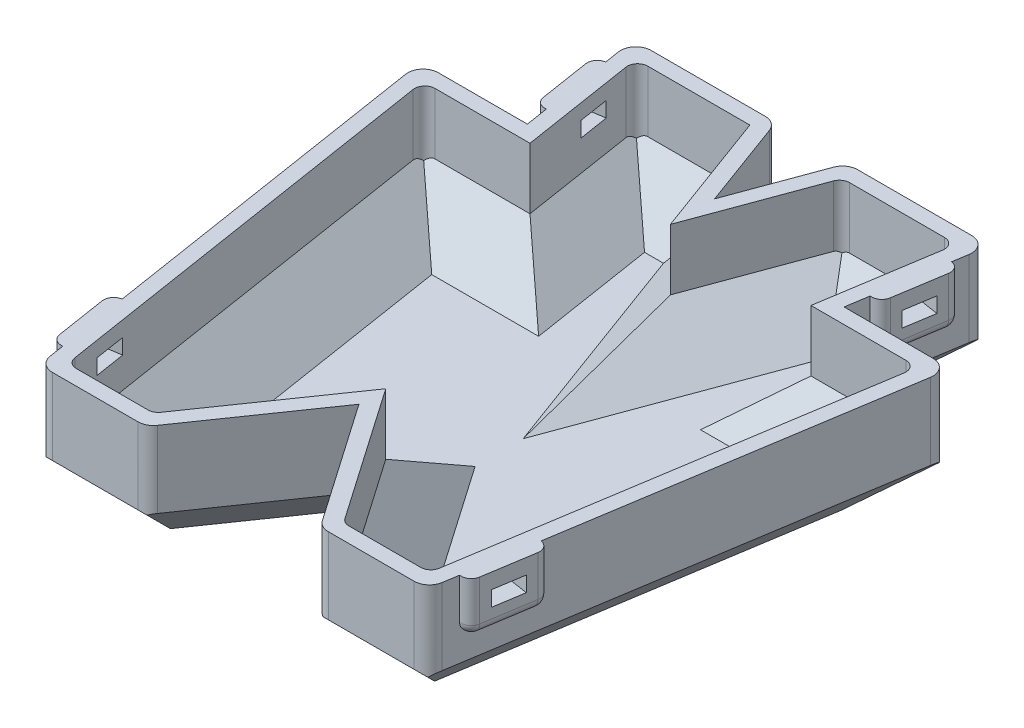
from build123d import *

# Parameters (mm, degrees)
BOSS_EXTRUDE2_DEPTH = 25
BOSS_EXTRUDE5_DEPTH = 3
CHAMFER2_SIZE       = 10
FILLET4_R           = 3
FILLET5_R           = 2
SKETCH5_W           = 14
SKETCH5_H           = 10
BOSS_EXTRUDE6_DEPTH = 2
SKETCH6_W           = 6
SKETCH6_H           = 3
CUT_EXTRUDE5_DEPTH  = 5
SKETCH7_W           = 14
SKETCH7_H           = 10
BOSS_EXTRUDE7_DEPTH = 2
SKETCH8_W           = 6
SKETCH8_H           = 3
CUT_EXTRUDE6_DEPTH  = 5
SKETCH9_W           = 6
SKETCH9_H           = 3
CUT_EXTRUDE7_DEPTH  = 5
SKETCH10_W          = 6
SKETCH10_H          = 3
CUT_EXTRUDE8_DEPTH  = 5
FILLET7_R           = 2


with BuildPart() as part:
    # Sketch1 → Boss-Extrude2 (new body)
    with BuildSketch(Plane(origin=(0, 0, 0), x_dir=(1, 0, 0), z_dir=(0, 1, 0))):
        Polygon((-35, 83.63691638), (-7, 83.63691638), (0, 64.624244097), (7, 83.63691638), (35, 83.63691638), (31.111111111, 58.941237745), (52.111111111, 58.941237745), (38.111111111, -29.963205338), (17.111111111, -29.963205338), (0, -5.267526704), (-17.111111111, -29.963205338), (-38.111111111, -29.963205338), (-52.111111111, 58.941237745), (-31.111111111, 58.941237745), align=None)
        Polygon((-48.6017252, 55.941237745), (-35.546559868, -26.963205338), (-18.682232195, -26.963205338), (0, 0), (18.682232195, -26.963205338), (35.546559868, -26.963205338), (48.6017252, 55.941237745), (27.6017252, 55.941237745), (31.490614089, 80.63691638), (9.092343668, 80.63691638), (0, 55.941237745), (-9.092343668, 80.63691638), (-31.490614089, 80.63691638), (-27.6017252, 55.941237745), align=None, mode=Mode.SUBTRACT)
    extrude(amount=BOSS_EXTRUDE2_DEPTH)

    # Sketch1<7> → Boss-Extrude5 (add)
    with BuildSketch(Plane(origin=(0, 0, 0), x_dir=(1, 0, 0), z_dir=(0, 1, 0))):
        Polygon((0, 55.941237745), (9.092343668, 80.63691638), (31.490614089, 80.63691638), (27.6017252, 55.941237745), (48.6017252, 55.941237745), (35.546559868, -26.963205338), (18.682232195, -26.963205338), (0, 0), (-18.682232195, -26.963205338), (-35.546559868, -26.963205338), (-48.6017252, 55.941237745), (-27.6017252, 55.941237745), (-31.490614089, 80.63691638), (-9.092343668, 80.63691638), align=None)
    extrude(amount=BOSS_EXTRUDE5_DEPTH)

    # Chamfer2
    chamfer2_edges = [part.edges().sort_by_distance(p)[0] for p in [
        (9.341116097, 3, 13.481602669),
        (27.114396032, 3, 26.963205338),
        (42.074142534, 3, -14.489016203),
        (38.1017252, 3, -55.941237745),
        (29.546169644, 3, -68.289077062),
        (20.291478878, 3, -80.63691638),
        (-4.546171834, 3, -68.289077062),
        (-20.291478878, 3, -80.63691638),
        (-29.546169644, 3, -68.289077062),
        (-38.1017252, 3, -55.941237745),
        (-42.074142534, 3, -14.489016203),
        (-27.114396032, 3, 26.963205338),
        (-9.341116097, 3, 13.481602669),
        (-27.611111111, 0, 29.963205338),
        (-45.111111111, 0, -14.489016203),
        (-41.611111111, 0, -58.941237745),
        (-33.055555556, 0, -71.289077062),
        (-21, 0, -83.63691638),
        (-3.5, 0, -74.130580238),
        (3.5, 0, -74.130580238),
        (21, 0, -83.63691638),
        (33.055555556, 0, -71.289077062),
        (41.611111111, 0, -58.941237745),
        (45.111111111, 0, -14.489016203),
        (27.611111111, 0, 29.963205338),
        (8.555555556, 0, 17.615366021),
        (-8.555555556, 0, 17.615366021),
        (4.546171834, 3, -68.289077062),
    ]]
    chamfer(chamfer2_edges, length=CHAMFER2_SIZE)

    # Fillet4
    fillet4_edges = [part.edges().sort_by_distance(p)[0] for p in [
        (-17.111111111, 17.5, 29.963205338),
        (-38.111111111, 17.5, 29.963205338),
        (-52.111111111, 17.5, -58.941237745),
        (-35, 17.5, -83.63691638),
        (-7, 17.5, -83.63691638),
        (7, 17.5, -83.63691638),
        (35, 17.5, -83.63691638),
        (52.111111111, 17.5, -58.941237745),
        (38.111111111, 17.5, 29.963205338),
        (17.111111111, 17.5, 29.963205338),
    ]]
    fillet(fillet4_edges, radius=FILLET4_R)

    # Fillet5
    fillet5_edges = [part.edges().sort_by_distance(p)[0] for p in [
        (-31.490614089, 19, -80.63691638),
        (-48.6017252, 19, -55.941237745),
        (-35.546559868, 19, 26.963205338),
        (-18.682232195, 19, 26.963205338),
        (18.682232195, 19, 26.963205338),
        (35.546559868, 19, 26.963205338),
        (48.6017252, 19, -55.941237745),
        (31.490614089, 19, -80.63691638),
        (9.092343668, 19, -80.63691638),
    ]]
    fillet(fillet5_edges, radius=FILLET5_R)

    # Sketch5 → Boss-Extrude6 (add)
    with BuildSketch(Plane(origin=(-21.301270542, 0, 3.354363148), x_dir=(0.15555555555555572, 0, 0.9878271453730164), z_dir=(-0.9878271453730165, 0, 0.15555555555555575))):
        with Locations((-74.553874888, 20)):
            Rectangle(SKETCH5_W, SKETCH5_H)
    boss_extrude6 = extrude(amount=BOSS_EXTRUDE6_DEPTH)

    # Sketch6 → Cut-Extrude5 (cut)
    with BuildSketch(Plane(origin=(-23.276924833, 0, 3.665474259), x_dir=(0.15555555555555592, 0, 0.9878271453730164), z_dir=(-0.9878271453730163, 0, 0.1555555555555559))):
        with Locations((-74.553874888, 20.5)):
            Rectangle(SKETCH6_W, SKETCH6_H)
    extrude(amount=-CUT_EXTRUDE5_DEPTH, mode=Mode.SUBTRACT)

    # Sketch7 → Boss-Extrude7 (add)
    with BuildSketch(Plane(origin=(-41.793122394, 0, 6.581265156), x_dir=(0.15555555555555553, 0, 0.9878271453730164), z_dir=(-0.9878271453730164, 0, 0.15555555555555553))):
        with Locations((11.105521291, 20)):
            Rectangle(SKETCH7_W, SKETCH7_H)
    boss_extrude7 = extrude(amount=BOSS_EXTRUDE7_DEPTH)

    # Sketch8 → Cut-Extrude6 (cut)
    with BuildSketch(Plane(origin=(-43.768776685, 0, 6.892376268), x_dir=(0.15555555555555564, 0, 0.9878271453730164), z_dir=(-0.9878271453730164, 0, 0.15555555555555564))):
        with Locations((11.105521291, 20.5)):
            Rectangle(SKETCH8_W, SKETCH8_H)
    extrude(amount=-CUT_EXTRUDE6_DEPTH, mode=Mode.SUBTRACT)

    # Mirror1: Boss-Extrude6, Boss-Extrude7 across plane
    add(boss_extrude6.mirror(Plane.ZY))
    add(boss_extrude7.mirror(Plane.ZY))

    # Sketch9 → Cut-Extrude7 (cut)
    with BuildSketch(Plane(origin=(43.768776685, 0, 6.892376268), x_dir=(0.1555555555555552, 0, -0.9878271453730165), z_dir=(0.9878271453730165, 0, 0.1555555555555552))):
        with Locations((-11.105521291, 20.5)):
            Rectangle(SKETCH9_W, SKETCH9_H)
    extrude(amount=-CUT_EXTRUDE7_DEPTH, mode=Mode.SUBTRACT)

    # Sketch10 → Cut-Extrude8 (cut)
    with BuildSketch(Plane(origin=(23.276924833, 0, 3.665474259), x_dir=(0.15555555555555514, 0, -0.9878271453730165), z_dir=(0.9878271453730165, 0, 0.15555555555555514))):
        with Locations((74.553874888, 20.5)):
            Rectangle(SKETCH10_W, SKETCH10_H)
    extrude(amount=-CUT_EXTRUDE8_DEPTH, mode=Mode.SUBTRACT)

    # Fillet7
    # the kernel refuses this fillet: 2 mm, written as the material it takes off along each edge
    with BuildSketch(Plane(origin=(-33.676317747, 17, -75.231113986), x_dir=(-0.15555555555555575, 0, -0.9878271453730165), z_dir=(-0.9878271453730165, 0, 0.15555555555555575))) as fillet7_piece_1_section:
        Polygon((0, 0), (FILLET7_R * 1.02, 0), (FILLET7_R * 1.02, FILLET7_R * 1.02), (0, FILLET7_R * 1.02), align=None)
    fillet7_piece_1 = extrude(amount=FILLET7_R * 1.02, mode=Mode.PRIVATE)
    fillet7_piece_1 = fillet7_piece_1 - Plane(origin=(-33.676317747, 17, -75.231113986), x_dir=(0.10999438818457417, 0.7071067811865475, 0.6984992731334093), z_dir=(-0.9878271453730165, 0, 0.15555555555555575)) * Sphere(FILLET7_R, mode=Mode.PRIVATE)
    add(fillet7_piece_1, mode=Mode.SUBTRACT)
    with BuildSketch(Plane(origin=(-32.120762192, 17, -65.352842532), x_dir=(-0.9878271453730165, 0, 0.15555555555555575), z_dir=(0.15555555555555575, 0, 0.9878271453730165))) as fillet7_piece_2_section:
        Polygon((0, 0), (FILLET7_R * 1.02, 0), (FILLET7_R * 1.02, FILLET7_R * 1.02), (0, FILLET7_R * 1.02), align=None)
    fillet7_piece_2 = extrude(amount=FILLET7_R * 1.02, mode=Mode.PRIVATE)
    fillet7_piece_2 = fillet7_piece_2 - Plane(origin=(-32.120762192, 17, -65.352842532), x_dir=(0.6984992731334094, 0.7071067811865475, -0.10999438818457428), z_dir=(0.15555555555555575, 0, 0.9878271453730165)) * Sphere(FILLET7_R, mode=Mode.PRIVATE)
    add(fillet7_piece_2, mode=Mode.SUBTRACT)
    with BuildSketch(Plane(origin=(-40.843374638, 17, 12.612464824), x_dir=(-0.9878271453730164, 0, 0.15555555555555553), z_dir=(0, -1, 0))) as fillet7_piece_3_section:
        Polygon((0, 0), (FILLET7_R * 1.02, 0), (FILLET7_R * 1.02, FILLET7_R * 1.02), (0, FILLET7_R * 1.02), align=None)
    fillet7_piece_3 = extrude(amount=FILLET7_R * 1.02, mode=Mode.PRIVATE)
    fillet7_piece_3 = fillet7_piece_3 - Plane(origin=(-40.843374638, 17, 12.612464824), x_dir=(0.8084936613179834, 0, 0.5885048849488352), z_dir=(0, -1, 0)) * Sphere(FILLET7_R, mode=Mode.PRIVATE)
    add(fillet7_piece_3, mode=Mode.SUBTRACT)
    with BuildSketch(Plane(origin=(-39.287819082, 17, 22.490736278), x_dir=(0.15555555555555553, 0, 0.9878271453730164), z_dir=(0, -1, 0))) as fillet7_piece_4_section:
        Polygon((0, 0), (FILLET7_R * 1.02, 0), (FILLET7_R * 1.02, FILLET7_R * 1.02), (0, FILLET7_R * 1.02), align=None)
    fillet7_piece_4 = extrude(amount=FILLET7_R * 1.02, mode=Mode.PRIVATE)
    fillet7_piece_4 = fillet7_piece_4 - Plane(origin=(-39.287819082, 17, 22.490736278), x_dir=(0.5885048849488352, 0, -0.8084936613179834), z_dir=(0, -1, 0)) * Sphere(FILLET7_R, mode=Mode.PRIVATE)
    add(fillet7_piece_4, mode=Mode.SUBTRACT)
    with BuildSketch(Plane(origin=(33.676317747, 17, -75.231113986), x_dir=(0.9878271453730165, 0, 0.15555555555555534), z_dir=(0.15555555555555534, 0, -0.9878271453730164))) as fillet7_piece_5_section:
        Polygon((0, 0), (FILLET7_R * 1.02, 0), (FILLET7_R * 1.02, FILLET7_R * 1.02), (0, FILLET7_R * 1.02), align=None)
    fillet7_piece_5 = extrude(amount=FILLET7_R * 1.02, mode=Mode.PRIVATE)
    fillet7_piece_5 = fillet7_piece_5 - Plane(origin=(33.676317747, 17, -75.231113986), x_dir=(-0.6984992731334094, 0.7071067811865475, -0.109994388184574), z_dir=(0.15555555555555534, 0, -0.9878271453730164)) * Sphere(FILLET7_R, mode=Mode.PRIVATE)
    add(fillet7_piece_5, mode=Mode.SUBTRACT)
    with BuildSketch(Plane(origin=(32.120762192, 17, -65.352842532), x_dir=(-0.15555555555555534, 0, 0.9878271453730164), z_dir=(0.9878271453730165, 0, 0.15555555555555534))) as fillet7_piece_6_section:
        Polygon((0, 0), (FILLET7_R * 1.02, 0), (FILLET7_R * 1.02, FILLET7_R * 1.02), (0, FILLET7_R * 1.02), align=None)
    fillet7_piece_6 = extrude(amount=FILLET7_R * 1.02, mode=Mode.PRIVATE)
    fillet7_piece_6 = fillet7_piece_6 - Plane(origin=(32.120762192, 17, -65.352842532), x_dir=(0.10999438818457391, 0.7071067811865475, -0.6984992731334094), z_dir=(0.9878271453730165, 0, 0.15555555555555534)) * Sphere(FILLET7_R, mode=Mode.PRIVATE)
    add(fillet7_piece_6, mode=Mode.SUBTRACT)
    with BuildSketch(Plane(origin=(40.843374638, 17, 12.612464824), x_dir=(0.15555555555555514, 0, -0.9878271453730165), z_dir=(0, -1, 0))) as fillet7_piece_7_section:
        Polygon((0, 0), (FILLET7_R * 1.02, 0), (FILLET7_R * 1.02, FILLET7_R * 1.02), (0, FILLET7_R * 1.02), align=None)
    fillet7_piece_7 = extrude(amount=FILLET7_R * 1.02, mode=Mode.PRIVATE)
    fillet7_piece_7 = fillet7_piece_7 - Plane(origin=(40.843374638, 17, 12.612464824), x_dir=(-0.8084936613179833, 0, 0.5885048849488356), z_dir=(0, -1, 0)) * Sphere(FILLET7_R, mode=Mode.PRIVATE)
    add(fillet7_piece_7, mode=Mode.SUBTRACT)
    with BuildSketch(Plane(origin=(39.287819082, 17, 22.490736278), x_dir=(0, -1, 0), z_dir=(-0.15555555555555514, 0, 0.9878271453730165))) as fillet7_piece_8_section:
        Polygon((0, 0), (FILLET7_R * 1.02, 0), (FILLET7_R * 1.02, FILLET7_R * 1.02), (0, FILLET7_R * 1.02), align=None)
    fillet7_piece_8 = extrude(amount=FILLET7_R * 1.02, mode=Mode.PRIVATE)
    fillet7_piece_8 = fillet7_piece_8 - Plane(origin=(39.287819082, 17, 22.490736278), x_dir=(-0.6984992731334094, 0.7071067811865475, -0.1099943881845739), z_dir=(-0.15555555555555514, 0, 0.9878271453730165)) * Sphere(FILLET7_R, mode=Mode.PRIVATE)
    add(fillet7_piece_8, mode=Mode.SUBTRACT)
    with BuildSketch(Plane(origin=(-35.963083149, 17, -76.895657166), x_dir=(0.15555555555555936, 0, 0.9878271453730157), z_dir=(0, 1, 0)), Plane(origin=(-43.13014004, 17, 10.947921645), x_dir=(0.15555555555555506, 0, 0.9878271453730165), z_dir=(0, 1, 0)), Plane(origin=(35.963083149, 17, -76.895657166), x_dir=(-0.9878271453730183, 0, -0.15555555555554387), z_dir=(0, 1, 0)), Plane(origin=(43.13014004, 17, 10.947921645), x_dir=(-0.9878271453730165, 0, -0.1555555555555548), z_dir=(0, 1, 0))) as fillet7_piece_9:
        with BuildLine():
            CenterArc((FILLET7_R, FILLET7_R), FILLET7_R, 180, 90)
            Line((0, FILLET7_R), (0, 0))
            Line((0, 0), (FILLET7_R, 0))
        make_face()
    extrude(amount=13, mode=Mode.SUBTRACT)
    with BuildSketch(Plane(origin=(-34.096416482, 15, -65.041731421), x_dir=(0, 1, 0), z_dir=(-0.15555555555555575, 0, -0.9878271453730165)), Plane(origin=(-41.263473373, 15, 22.801847389), x_dir=(0, 1, 0), z_dir=(-0.15555555555555553, 0, -0.9878271453730164))) as fillet7_piece_10:
        with BuildLine():
            CenterArc((FILLET7_R, FILLET7_R), FILLET7_R, 180, 90)
            Line((0, FILLET7_R), (0, 0))
            Line((0, 0), (FILLET7_R, 0))
        make_face()
    extrude(amount=10, mode=Mode.SUBTRACT)
    with BuildSketch(Plane(origin=(-33.785305371, 30, -63.06607713), x_dir=(0.9878271453730171, 0, -0.15555555555555162), z_dir=(0, -1, 0)), Plane(origin=(-40.952362262, 30, 24.77750168), x_dir=(0.9878271453730165, 0, -0.1555555555555548), z_dir=(0, -1, 0)), Plane(origin=(33.785305371, 30, -63.06607713), x_dir=(0.1555555555555548, 0, -0.9878271453730165), z_dir=(0, -1, 0)), Plane(origin=(40.952362262, 30, 24.77750168), x_dir=(0.15555555555555506, 0, -0.9878271453730165), z_dir=(0, -1, 0))) as fillet7_piece_11:
        with BuildLine():
            CenterArc((FILLET7_R, -FILLET7_R), FILLET7_R, 90, 90)
            Line((0, -FILLET7_R), (0, 0))
            Line((0, 0), (FILLET7_R, 0))
        make_face()
    extrude(amount=13, mode=Mode.SUBTRACT)
    with BuildSketch(Plane(origin=(34.096416482, 15, -65.041731421), x_dir=(0, 1, 0), z_dir=(0.15555555555555534, 0, -0.9878271453730165)), Plane(origin=(41.263473373, 15, 22.801847389), x_dir=(0, 1, 0), z_dir=(0.1555555555555552, 0, -0.9878271453730165))) as fillet7_piece_12:
        with BuildLine():
            CenterArc((FILLET7_R, -FILLET7_R), FILLET7_R, 90, 90)
            Line((0, -FILLET7_R), (0, 0))
            Line((0, 0), (FILLET7_R, 0))
        make_face()
    extrude(amount=10, mode=Mode.SUBTRACT)


solid = part.part
